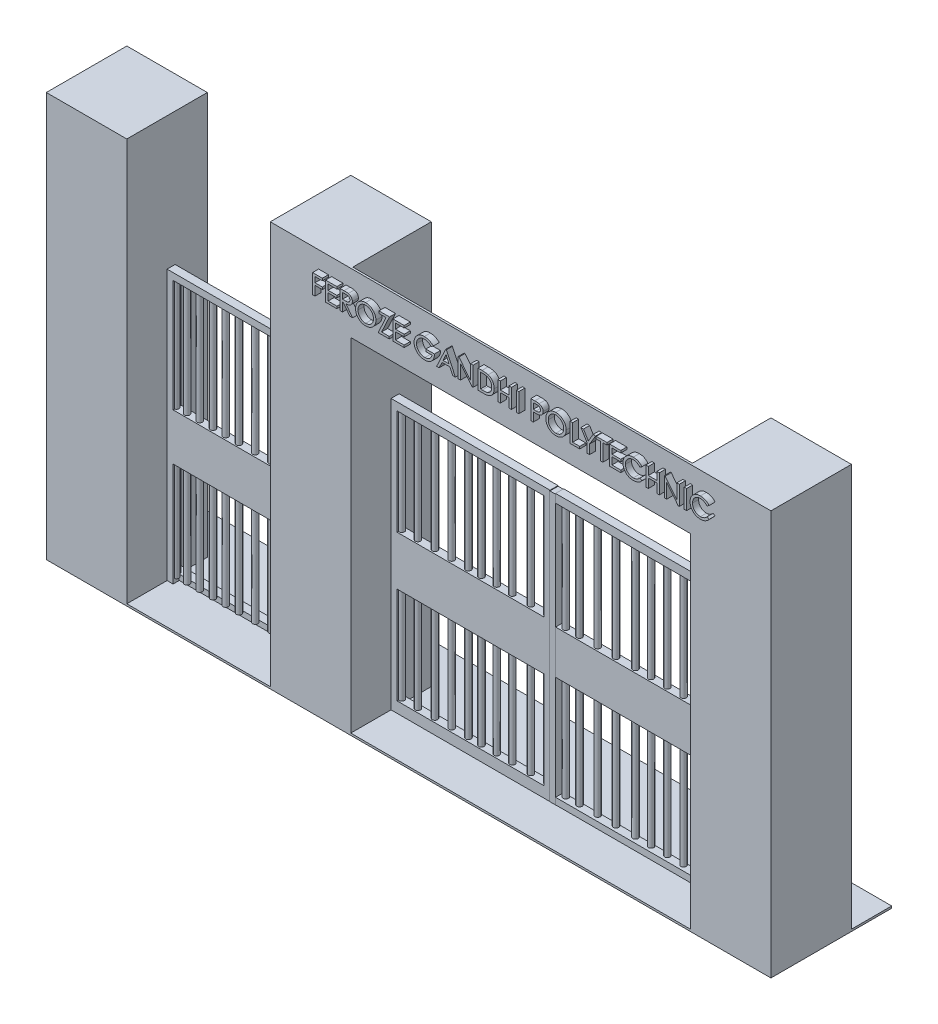
from build123d import *

# Parameters (mm, degrees)
SKETCH1_W            = 180
SKETCH1_H            = 0.5
BOSS_EXTRUDE1_DEPTH  = 30
SKETCH2_W            = 20
SKETCH2_H            = 20
BOSS_EXTRUDE2_DEPTH  = 100
SKETCH3_W            = 18.9993131
SKETCH3_H            = 18.969298387
CUT_EXTRUDE1_DEPTH   = 99
SKETCH4_W            = 19.144751785
SKETCH4_H            = 19.144751784
CUT_EXTRUDE2_DEPTH   = 99
SKETCH5_W            = 19.220337381
SKETCH5_H            = 18.980083164
CUT_EXTRUDE3_DEPTH   = 99
SKETCH7_W            = 20
SKETCH7_H            = 20
BOSS_EXTRUDE3_DEPTH  = 0.1
SKETCH8_W            = 20
SKETCH8_H            = 20
BOSS_EXTRUDE4_DEPTH  = 0.1
SKETCH9_W            = 20
SKETCH9_H            = 20
BOSS_EXTRUDE5_DEPTH  = 0.1
SKETCH10_W           = 2
SKETCH10_H           = 67
BOSS_EXTRUDE6_DEPTH  = 1.5
SKETCH11_W           = 2
SKETCH11_H           = 1.673709461
SKETCH11_H_2         = 11.6345523
BOSS_EXTRUDE7_DEPTH  = 34
SKETCH12_W           = 2.023275833
SKETCH12_H           = 1.367785379
BOSS_EXTRUDE8_DEPTH  = 34
SKETCH13_R           = 0.668926332
SKETCH13_R_2         = 0.67
BOSS_EXTRUDE9_DEPTH  = 66
SKETCH14_W           = 2
SKETCH14_H           = 67
BOSS_EXTRUDE10_DEPTH = 1.7
SKETCH15_W           = 124.368826355
SKETCH15_H           = 14.892612829
BOSS_EXTRUDE11_DEPTH = 0.5
SKETCH16_W           = 0.610576923
SKETCH16_H           = 4.7625
BOSS_EXTRUDE12_DEPTH = 1.5
SKETCH17_W           = 2
SKETCH17_H           = 67
BOSS_EXTRUDE13_DEPTH = 1.5
SKETCH18_W           = 2
SKETCH18_H           = 1.919088728
SKETCH18_H_2         = 12.226633401
SKETCH18_H_3         = 2.676174389
BOSS_EXTRUDE14_DEPTH = 38
SKETCH20_W           = 2
SKETCH20_H           = 67
BOSS_EXTRUDE15_DEPTH = 1.5
SKETCH21_W           = 2
SKETCH21_H           = 67
BOSS_EXTRUDE16_DEPTH = 1.5
SKETCH22_W           = 2
SKETCH22_H           = 2.09794553
SKETCH22_H_2         = 10.803390943
SKETCH22_H_3         = 1.625050374
BOSS_EXTRUDE17_DEPTH = 42
SKETCH23_W           = 2.02893277
SKETCH23_H           = 66.865731081
BOSS_EXTRUDE18_DEPTH = 1.5
SKETCH24_R           = 0.67
BOSS_EXTRUDE19_DEPTH = 65
SKETCH25_R           = 0.67
BOSS_EXTRUDE20_DEPTH = 65


with BuildPart() as part:
    # Sketch1 → Boss-Extrude1 (new body)
    with BuildSketch(Plane.XY):
        with Locations((-90, 0.25)):
            Rectangle(SKETCH1_W, SKETCH1_H)
    extrude(amount=BOSS_EXTRUDE1_DEPTH)

    # Sketch2 → Boss-Extrude2 (add)
    with BuildSketch(Plane(origin=(0, 0.5, 0), x_dir=(1, 0, 0), z_dir=(0, 1, 0))):
        with Locations((-170, -20)):
            Rectangle(SKETCH2_W, SKETCH2_H)
        with Locations((-10, -20)):
            Rectangle(SKETCH2_W, SKETCH2_H)
        with Locations((-114.368826355, -20)):
            Rectangle(SKETCH2_W, SKETCH2_H)
    extrude(amount=BOSS_EXTRUDE2_DEPTH)

    # Sketch3 → Cut-Extrude1 (cut)
    with BuildSketch(Plane(origin=(0, 100.5, 0), x_dir=(1, 0, 0), z_dir=(0, 1, 0))):
        with Locations((-170.020602194, -19.99181704)):
            Rectangle(SKETCH3_W, SKETCH3_H)
    extrude(amount=-CUT_EXTRUDE1_DEPTH, mode=Mode.SUBTRACT)

    # Sketch4 → Cut-Extrude2 (cut)
    with BuildSketch(Plane(origin=(0, 100.5, 0), x_dir=(1, 0, 0), z_dir=(0, 1, 0))):
        with Locations((-114.383441003, -20.067839378)):
            Rectangle(SKETCH4_W, SKETCH4_H)
    extrude(amount=-CUT_EXTRUDE2_DEPTH, mode=Mode.SUBTRACT)

    # Sketch5 → Cut-Extrude3 (cut)
    with BuildSketch(Plane(origin=(0, 100.5, 0), x_dir=(1, 0, 0), z_dir=(0, 1, 0))):
        with Locations((-10.033138449, -20.09517167)):
            Rectangle(SKETCH5_W, SKETCH5_H)
    extrude(amount=-CUT_EXTRUDE3_DEPTH, mode=Mode.SUBTRACT)

    # Sketch7 → Boss-Extrude3 (add)
    with BuildSketch(Plane(origin=(0, 100.5, 0), x_dir=(1, 0, 0), z_dir=(0, 1, 0))):
        with Locations((-170, -20)):
            Rectangle(SKETCH7_W, SKETCH7_H)
    extrude(amount=-BOSS_EXTRUDE3_DEPTH)

    # Sketch8 → Boss-Extrude4 (add)
    with BuildSketch(Plane(origin=(0, 100.5, 0), x_dir=(1, 0, 0), z_dir=(0, 1, 0))):
        with Locations((-114.368826355, -20)):
            Rectangle(SKETCH8_W, SKETCH8_H)
    extrude(amount=-BOSS_EXTRUDE4_DEPTH)

    # Sketch9 → Boss-Extrude5 (add)
    with BuildSketch(Plane(origin=(0, 100.5, 0), x_dir=(1, 0, 0), z_dir=(0, 1, 0))):
        with Locations((-10, -20)):
            Rectangle(SKETCH9_W, SKETCH9_H)
    extrude(amount=-BOSS_EXTRUDE5_DEPTH)

    # Sketch10 → Boss-Extrude6 (add)
    with BuildSketch(Plane(origin=(-160, 0, 0), x_dir=(0, 0, -1), z_dir=(1, 0, 0))):
        with Locations((-19, 34)):
            Rectangle(SKETCH10_W, SKETCH10_H)
    extrude(amount=BOSS_EXTRUDE6_DEPTH)

    # Sketch11 → Boss-Extrude7 (add)
    with BuildSketch(Plane(origin=(-158.5, 0, 0), x_dir=(0, 0, -1), z_dir=(1, 0, 0))):
        with Locations((-19, 66.66314527)):
            Rectangle(SKETCH11_W, SKETCH11_H)
        with Locations((-19, 32.144750477)):
            Rectangle(SKETCH11_W, SKETCH11_H_2)
    extrude(amount=BOSS_EXTRUDE7_DEPTH)

    # Sketch12 → Boss-Extrude8 (add)
    with BuildSketch(Plane(origin=(-160, 0, 0), x_dir=(0, 0, -1), z_dir=(1, 0, 0))):
        with Locations((-17.506346466, 1.240598384)):
            Rectangle(SKETCH12_W, SKETCH12_H)
    extrude(amount=BOSS_EXTRUDE8_DEPTH)

    # Sketch13 → Boss-Extrude9 (add)
    with BuildSketch(Plane(origin=(0, 67.5, 0), x_dir=(1, 0, 0), z_dir=(0, 1, 0))):
        with Locations((-158.696712227, -19)):
            Circle(SKETCH13_R)
        with Locations((-156.001147087, -19)):
            Circle(SKETCH13_R_2)
        with Locations((-152.870813376, -19)):
            Circle(SKETCH13_R_2)
        with Locations((-149.595556808, -19)):
            Circle(SKETCH13_R_2)
        with Locations((-146.407253955, -19)):
            Circle(SKETCH13_R_2)
        with Locations((-143.131997387, -19)):
            Circle(SKETCH13_R_2)
        with Locations((-139.074157391, -19)):
            Circle(SKETCH13_R_2)
        with Locations((-135.074286539, -19)):
            Circle(SKETCH13_R_2)
        with Locations((-131.422230543, -19)):
            Circle(SKETCH13_R_2)
        with Locations((-127.712205404, -19)):
            Circle(SKETCH13_R_2)
    extrude(amount=-BOSS_EXTRUDE9_DEPTH)

    # Sketch14 → Boss-Extrude10 (add)
    with BuildSketch(Plane.ZY.offset(124.368826355)):
        with Locations((19.075616375, 33.996761098)):
            Rectangle(SKETCH14_W, SKETCH14_H)
    extrude(amount=BOSS_EXTRUDE10_DEPTH)

    # Sketch15 → Boss-Extrude11 (add)
    with BuildSketch(Plane.XY.offset(30)):
        with Locations((-62.184413178, 93.053693585)):
            Rectangle(SKETCH15_W, SKETCH15_H)
    extrude(amount=-BOSS_EXTRUDE11_DEPTH)

    # Sketch16 → Boss-Extrude12 (add)
    # profile 1 of 23: a face of its own
    with BuildSketch(Plane.XY.offset(30)):
        Polygon((-112.366769524, 96.332104114), (-109.924461832, 96.332104114), (-109.924461832, 95.782584883), (-111.756192601, 95.782584883), (-111.756192601, 94.439315652), (-109.924461832, 94.439315652), (-109.924461832, 93.889796422), (-111.756192601, 93.889796422), (-111.756192601, 91.569604114), (-112.366769524, 91.569604114), align=None)
    # profile 2 of 23: a face of its own
    with BuildSketch(Plane.XY.offset(30)):
        Polygon((-109.130711832, 96.332104114), (-106.322057986, 96.332104114), (-106.322057986, 95.782584883), (-108.520134909, 95.782584883), (-108.520134909, 94.439315652), (-106.322057986, 94.439315652), (-106.322057986, 93.889796422), (-108.520134909, 93.889796422), (-108.520134909, 92.119123345), (-106.322057986, 92.119123345), (-106.322057986, 91.569604114), (-109.130711832, 91.569604114), align=None)
    # profile 3 of 23: a face of its own
    with BuildSketch(Plane.XY.offset(30)):
        with BuildLine():
            Line((-105.528307986, 96.332104114), (-104.553292962, 96.332104114))
            add(Edge.make_bspline(
                [(-104.553292962, 96.332104114), (-104.490643227, 96.331952632), (-104.370742867, 96.331662723), (-104.198695352, 96.328620523), (-104.042480786, 96.324591398), (-103.901981105, 96.316175141), (-103.776820067, 96.308746234), (-103.667539014, 96.296527763), (-103.573623442, 96.285630209), (-103.517158493, 96.273640712), (-103.491461532, 96.268184342)],
                knots=[0, 0, 0, 0, 1.411347063, 2.701065231, 3.876524531, 4.931206492, 5.871916627, 6.700262025, 7.408494688, 8, 8, 8, 8], degree=3))
            add(Edge.make_bspline(
                [(-103.491461532, 96.268184342), (-103.453145404, 96.258552152), (-103.377656796, 96.239575269), (-103.268900466, 96.202213809), (-103.166224756, 96.158167327), (-103.069764993, 96.107678083), (-102.979289249, 96.050492475), (-102.896547926, 95.984885346), (-102.818281512, 95.91420797), (-102.747509906, 95.836242922), (-102.683118448, 95.753336299), (-102.628062065, 95.665502712), (-102.580823204, 95.57392177), (-102.541397056, 95.478729608), (-102.511917474, 95.378864696), (-102.491268735, 95.275062025), (-102.477058095, 95.167629883), (-102.475971751, 95.094460377), (-102.47542337, 95.057524787)],
                knots=[0, 0, 0, 0, 1.103820101, 2.174693741, 3.209859002, 4.223626675, 5.214778413, 6.196198804, 7.171320727, 8.158999421, 9.134971582, 10.10159085, 11.051641808, 12.012235658, 12.97676874, 13.956376421, 14.968389326, 16, 16, 16, 16], degree=3))
            add(Edge.make_bspline(
                [(-102.47542337, 95.057524787), (-102.47746479, 94.996609765), (-102.481476869, 94.876891168), (-102.51793871, 94.702290553), (-102.577689416, 94.537703902), (-102.64584129, 94.409132753), (-102.71214081, 94.313547964), (-102.767648048, 94.245594511), (-102.828672228, 94.181932614), (-102.894780651, 94.121899491), (-102.967713061, 94.068148048), (-103.04524455, 94.017183267), (-103.128289707, 93.970332261), (-103.247994851, 93.914076007), (-103.409903073, 93.855441126), (-103.619100869, 93.805173348), (-103.845154929, 93.774639158), (-104.001450841, 93.770047515), (-104.082003899, 93.767681037)],
                knots=[0, 0, 0, 0, 1.258986715, 2.474334223, 3.670931197, 4.871716255, 5.472099774, 6.075216246, 6.684756624, 7.295006596, 7.919971941, 8.55677058, 9.213641309, 9.890468445, 11.291088691, 12.766994829, 14.333747493, 16, 16, 16, 16], degree=3))
            Line((-104.082003899, 93.767681037), (-102.414365678, 91.569604114))
            Line((-102.414365678, 91.569604114), (-103.08695432, 91.569604114))
            Line((-103.08695432, 91.569604114), (-104.754592541, 93.767681037))
            Line((-104.754592541, 93.767681037), (-104.917731063, 93.767681037))
            Line((-104.917731063, 93.767681037), (-104.917731063, 91.569604114))
            Line((-104.917731063, 91.569604114), (-105.528307986, 91.569604114))
            Line((-105.528307986, 91.569604114), (-105.528307986, 96.332104114))
        make_face()
        with BuildLine():
            Line((-104.917731063, 95.782584883), (-104.917731063, 94.316246241))
            Line((-104.917731063, 94.316246241), (-104.217475654, 94.311476109))
            add(Edge.make_bspline(
                [(-104.217475654, 94.311476109), (-104.179947098, 94.311573075), (-104.10741243, 94.31176049), (-104.002419754, 94.315619603), (-103.905036513, 94.322081801), (-103.815647377, 94.331652699), (-103.734511621, 94.343071103), (-103.661007311, 94.355859811), (-103.595824641, 94.37312865), (-103.519683096, 94.398021055), (-103.435088881, 94.438013056), (-103.345350096, 94.49890254), (-103.266690884, 94.570963751), (-103.202186256, 94.655400742), (-103.150575657, 94.748037419), (-103.113030126, 94.846945511), (-103.09041298, 94.951567506), (-103.087487931, 95.023068473), (-103.086000294, 95.05943284)],
                knots=[0, 0, 0, 0, 1.165824803, 2.253289887, 3.263370799, 4.197285623, 5.045371766, 5.808848116, 6.513348392, 7.138183875, 8.296069948, 9.40583476, 10.496436725, 11.595152671, 12.691956992, 13.780050175, 14.870965332, 16, 16, 16, 16], degree=3))
            add(Edge.make_bspline(
                [(-103.086000294, 95.05943284), (-103.087558309, 95.094511438), (-103.090648574, 95.16408852), (-103.112627864, 95.266201758), (-103.151915176, 95.36253568), (-103.204040498, 95.452966452), (-103.268626292, 95.534262854), (-103.34290143, 95.605899009), (-103.42870462, 95.662680633), (-103.507699444, 95.701004412), (-103.578496148, 95.725039648), (-103.641183666, 95.739882799), (-103.712536386, 95.752988919), (-103.792700097, 95.764508095), (-103.881526645, 95.772924125), (-103.979237604, 95.778218902), (-104.085784755, 95.782379089), (-104.159911357, 95.782514554), (-104.198395125, 95.782584883)],
                knots=[0, 0, 0, 0, 1.114111647, 2.20979856, 3.297775031, 4.406653707, 5.514151176, 6.585969385, 7.670234779, 8.768154562, 9.365517569, 10.041721951, 10.812428959, 11.669578816, 12.61341719, 13.645562296, 14.777663698, 16, 16, 16, 16], degree=3))
            Line((-104.198395125, 95.782584883), (-104.917731063, 95.782584883))
        make_face(mode=Mode.SUBTRACT)
    # profile 4 of 23: a face of its own
    with BuildSketch(Plane.XY.offset(30)):
        with BuildLine():
            add(Edge.make_bspline(
                [(-99.207882806, 96.454219498), (-99.116501085, 96.452109818), (-98.936888485, 96.447963199), (-98.673397936, 96.412608972), (-98.421772763, 96.356049544), (-98.182384114, 96.275262504), (-97.955070374, 96.171749843), (-97.739472927, 96.045312625), (-97.536232003, 95.895567823), (-97.347832477, 95.724435027), (-97.176694842, 95.538019716), (-97.025030225, 95.340966575), (-96.899089848, 95.132403139), (-96.793809997, 94.915347445), (-96.714148717, 94.68778585), (-96.655128244, 94.451646392), (-96.620319442, 94.205347109), (-96.616050715, 94.03778), (-96.613884909, 93.952762167)],
                knots=[0, 0, 0, 0, 1.090651108, 2.14369656, 3.167927427, 4.165692988, 5.154576575, 6.145033357, 7.14440862, 8.163220312, 9.178978109, 10.162394332, 11.12677451, 12.082874982, 13.037579715, 13.999894772, 14.985214855, 16, 16, 16, 16], degree=3))
            add(Edge.make_bspline(
                [(-96.613884909, 93.952762167), (-96.616009073, 93.868369622), (-96.620195398, 93.702047838), (-96.655673021, 93.457249414), (-96.71286877, 93.22139609), (-96.792967126, 92.994028577), (-96.898041023, 92.776881153), (-97.024611274, 92.56813197), (-97.175363416, 92.36977497), (-97.345862438, 92.18205474), (-97.533229342, 92.010307546), (-97.73441172, 91.859475031), (-97.946969226, 91.732522144), (-98.169842966, 91.626839682), (-98.404856141, 91.547496423), (-98.650253982, 91.488660077), (-98.907002448, 91.453898004), (-99.081846206, 91.449647966), (-99.170675774, 91.447488729)],
                knots=[0, 0, 0, 0, 1.015667565, 2.001689161, 2.971180881, 3.933912672, 4.898051938, 5.870540525, 6.8683264, 7.892867857, 8.919988739, 9.923897136, 10.914753654, 11.896185405, 12.887840524, 13.895451133, 14.930781579, 16, 16, 16, 16], degree=3))
            add(Edge.make_bspline(
                [(-99.170675774, 91.447488729), (-99.257297668, 91.449582679), (-99.427743767, 91.45370295), (-99.677790928, 91.489393718), (-99.917690261, 91.545033143), (-100.147131805, 91.624997557), (-100.366479999, 91.726990717), (-100.574485156, 91.85351084), (-100.772985172, 92.000867904), (-100.958204321, 92.169678417), (-101.127241938, 92.354535936), (-101.275513634, 92.551309732), (-101.401619546, 92.757496605), (-101.504204498, 92.973332389), (-101.584121458, 93.19902207), (-101.639560512, 93.434511403), (-101.675450345, 93.679129184), (-101.679578648, 93.845465576), (-101.68167337, 93.929865532)],
                knots=[0, 0, 0, 0, 1.056734814, 2.079339537, 3.076314658, 4.058285941, 5.039336339, 6.023146808, 7.024524339, 8.052147497, 9.076900738, 10.077495695, 11.054668894, 12.021676166, 12.988994953, 13.970866516, 14.970407042, 16, 16, 16, 16], degree=3))
            add(Edge.make_bspline(
                [(-101.68167337, 93.929865532), (-101.680946554, 93.986515961), (-101.67950209, 94.099102147), (-101.662086398, 94.266284647), (-101.636866157, 94.430796677), (-101.600531783, 94.592084588), (-101.553666224, 94.750177086), (-101.49590239, 94.904742035), (-101.429741925, 95.057085819), (-101.350828338, 95.204184434), (-101.265150281, 95.346892149), (-101.16994333, 95.481376114), (-101.069235453, 95.609273922), (-100.958786488, 95.727171358), (-100.842289306, 95.83852475), (-100.717839955, 95.941615848), (-100.586201572, 96.037376134), (-100.446806716, 96.123673075), (-100.303090433, 96.201722475), (-100.154940243, 96.268699349), (-100.004368266, 96.326184169), (-99.850669263, 96.372776149), (-99.694251384, 96.409559026), (-99.534773241, 96.434606175), (-99.372361886, 96.452056408), (-99.262945055, 96.453495366), (-99.207882806, 96.454219498)],
                knots=[0, 0, 0, 0, 1.036913812, 2.060746492, 3.074578145, 4.08324605, 5.085523353, 6.091481477, 7.103103322, 8.124200051, 9.145827961, 10.149052085, 11.139400635, 12.124186929, 13.104469564, 14.088618662, 15.081002312, 16.082788945, 17.088477375, 18.073521874, 19.057670972, 20.037642247, 21.012252997, 21.997331918, 22.992189685, 24, 24, 24, 24], degree=3))
        make_face()
        with BuildLine():
            add(Edge.make_bspline(
                [(-99.18784825, 95.904700268), (-99.227952845, 95.904065432), (-99.307721779, 95.90280273), (-99.4265562, 95.889585475), (-99.544160069, 95.869731251), (-99.66073709, 95.841808405), (-99.776383376, 95.806918228), (-99.890103539, 95.7622839), (-100.002996348, 95.711214521), (-100.113048099, 95.650678123), (-100.220330191, 95.584966006), (-100.32180331, 95.511607156), (-100.418632051, 95.433629689), (-100.509421049, 95.348406545), (-100.593999853, 95.257053463), (-100.672838146, 95.159720702), (-100.746537666, 95.056744911), (-100.813484511, 94.947412321), (-100.875317453, 94.833985745), (-100.927366842, 94.715730875), (-100.971456532, 94.59390592), (-101.007642357, 94.468639151), (-101.036634531, 94.339682756), (-101.056031909, 94.20698893), (-101.06929107, 94.070694849), (-101.070488508, 93.978553664), (-101.071096447, 93.931773585)],
                knots=[0, 0, 0, 0, 0.951425037, 1.892405618, 2.834142553, 3.780555396, 4.735506122, 5.698386817, 6.677778342, 7.674036042, 8.677244726, 9.661625187, 10.643485342, 11.625954439, 12.613944774, 13.595804929, 14.596853729, 15.616869823, 16.636634596, 17.660413109, 18.67984269, 19.709280547, 20.753005387, 21.813969624, 22.890152378, 24, 24, 24, 24], degree=3))
            add(Edge.make_bspline(
                [(-101.071096447, 93.931773585), (-101.069619673, 93.863622415), (-101.06672319, 93.729953531), (-101.038789415, 93.533887209), (-100.995482455, 93.346531635), (-100.934183469, 93.168076431), (-100.855254514, 92.998575596), (-100.758651465, 92.838078094), (-100.644212383, 92.686181751), (-100.513302545, 92.545805466), (-100.371383169, 92.417540527), (-100.220849037, 92.305771913), (-100.065146559, 92.209123151), (-99.901776966, 92.131656205), (-99.732341597, 92.071284995), (-99.556552807, 92.028326688), (-99.374378129, 92.001766123), (-99.250586562, 91.998608342), (-99.18784825, 91.99700796)],
                knots=[0, 0, 0, 0, 1.087324682, 2.132633634, 3.154656843, 4.153212625, 5.138884617, 6.133989092, 7.13811672, 8.169089965, 9.193543553, 10.187520856, 11.158295186, 12.114249704, 13.068004623, 14.02467326, 14.998892505, 16, 16, 16, 16], degree=3))
            add(Edge.make_bspline(
                [(-99.18784825, 91.99700796), (-99.143296402, 91.997644468), (-99.054969411, 91.998906389), (-98.924034408, 92.011939259), (-98.795690129, 92.032034202), (-98.669860955, 92.05908535), (-98.546921501, 92.096394302), (-98.425944029, 92.139315857), (-98.308256462, 92.192843611), (-98.193013357, 92.252060778), (-98.083156755, 92.32016357), (-97.977448607, 92.392561534), (-97.878025095, 92.471336497), (-97.786793151, 92.558063381), (-97.700033433, 92.648813465), (-97.620100851, 92.746133036), (-97.546436425, 92.849386745), (-97.479779022, 92.958243949), (-97.419989788, 93.071400697), (-97.366847514, 93.18801773), (-97.323653934, 93.308267072), (-97.286589431, 93.43097253), (-97.259261504, 93.55738639), (-97.239501313, 93.686743813), (-97.226309556, 93.819244743), (-97.22508276, 93.908527045), (-97.224461832, 93.953716193)],
                knots=[0, 0, 0, 0, 1.036970321, 2.055862331, 3.060095599, 4.060719653, 5.049301004, 6.049377071, 7.046955997, 8.056986028, 9.063944937, 10.053856218, 11.039021426, 12.013303897, 12.982198174, 13.960523328, 14.942567566, 15.933032457, 16.929951754, 17.920776327, 18.913894254, 19.902475604, 20.903099658, 21.921964767, 22.948227815, 24, 24, 24, 24], degree=3))
            add(Edge.make_bspline(
                [(-97.224461832, 93.953716193), (-97.225085605, 93.998587256), (-97.226317933, 94.087234674), (-97.239435043, 94.218474723), (-97.259238353, 94.346249028), (-97.286758415, 94.47102112), (-97.323466295, 94.592244343), (-97.366882147, 94.710846488), (-97.419992469, 94.825565802), (-97.479815627, 94.936796763), (-97.546602617, 95.04420897), (-97.621121606, 95.145787463), (-97.701324808, 95.242707051), (-97.788400155, 95.333539623), (-97.882405074, 95.41861618), (-97.982446833, 95.498573937), (-98.088826555, 95.573721031), (-98.201807212, 95.641395989), (-98.318371836, 95.703577893), (-98.437900343, 95.756605912), (-98.558325479, 95.803015901), (-98.680757614, 95.84029988), (-98.805173556, 95.868727966), (-98.931264391, 95.889937419), (-99.05910684, 95.902686977), (-99.144888842, 95.904028458), (-99.18784825, 95.904700268)],
                knots=[0, 0, 0, 0, 1.048789873, 2.071992723, 3.080474812, 4.070813472, 5.056451928, 6.039816187, 7.021295338, 8.009314668, 8.991328769, 9.975844821, 10.952581135, 11.930703152, 12.91499457, 13.914777939, 14.923479275, 15.957618598, 16.991998452, 18.010408503, 19.012925223, 20.00783076, 20.999814803, 21.994803685, 22.995802798, 24, 24, 24, 24], degree=3))
        make_face(mode=Mode.SUBTRACT)
    # profile 5 of 23: a face of its own
    with BuildSketch(Plane.XY.offset(30)):
        Polygon((-95.881192601, 95.782584883), (-95.881192601, 96.332104114), (-93.255711832, 96.332104114), (-95.22196033, 92.119123345), (-93.316769524, 92.119123345), (-93.316769524, 91.569604114), (-96.064365678, 91.569604114), (-94.097163154, 95.782584883), align=None)
    # profile 6 of 23: a face of its own
    with BuildSketch(Plane.XY.offset(30)):
        Polygon((-92.40090414, 96.332104114), (-89.592250294, 96.332104114), (-89.592250294, 95.782584883), (-91.790327217, 95.782584883), (-91.790327217, 94.439315652), (-89.592250294, 94.439315652), (-89.592250294, 93.889796422), (-91.790327217, 93.889796422), (-91.790327217, 92.119123345), (-89.592250294, 92.119123345), (-89.592250294, 91.569604114), (-92.40090414, 91.569604114), align=None)
    # profile 7 of 23: a face of its own
    with BuildSketch(Plane.XY.offset(30)):
        with BuildLine():
            Line((-82.387442601, 95.513549426), (-82.850145426, 95.110950268))
            add(Edge.make_bspline(
                [(-82.850145426, 95.110950268), (-82.922737165, 95.174337504), (-83.064054303, 95.297735881), (-83.285327083, 95.460738954), (-83.507838002, 95.598227584), (-83.731645976, 95.708560432), (-83.952973202, 95.796929816), (-84.172828221, 95.85768346), (-84.389462905, 95.897374734), (-84.533520023, 95.902279955), (-84.604600053, 95.904700268)],
                knots=[0, 0, 0, 0, 1.174203348, 2.285866929, 3.345479548, 4.357773815, 5.323690501, 6.245291137, 7.134199255, 8, 8, 8, 8], degree=3))
            add(Edge.make_bspline(
                [(-84.604600053, 95.904700268), (-84.645657478, 95.904057115), (-84.727643954, 95.902772819), (-84.849965454, 95.889566502), (-84.9710943, 95.86986683), (-85.091104233, 95.841673244), (-85.210249141, 95.806910844), (-85.327617019, 95.762580898), (-85.443930057, 95.710726591), (-85.55824556, 95.651052046), (-85.669355603, 95.584853479), (-85.774957787, 95.511998527), (-85.874393738, 95.43260549), (-85.967849798, 95.346898994), (-86.054777111, 95.254748223), (-86.136463893, 95.157478871), (-86.210794475, 95.052810752), (-86.279215776, 94.942997889), (-86.339553854, 94.828820175), (-86.393862442, 94.713025157), (-86.438570975, 94.594630819), (-86.474753376, 94.474031329), (-86.503571693, 94.351384416), (-86.524491583, 94.226825189), (-86.537437286, 94.099958315), (-86.538719018, 94.014804568), (-86.539365678, 93.971842696)],
                knots=[0, 0, 0, 0, 0.9732313, 1.943419598, 2.914105962, 3.881741322, 4.864768402, 5.855028487, 6.854206409, 7.882911434, 8.911035887, 9.919250175, 10.922630637, 11.925982763, 12.923451909, 13.924676513, 14.935397504, 15.964931351, 16.990480746, 17.995899336, 18.995873688, 19.988284801, 20.979664002, 21.981342857, 22.981544644, 24, 24, 24, 24], degree=3))
            add(Edge.make_bspline(
                [(-86.539365678, 93.971842696), (-86.538271979, 93.927934996), (-86.536088345, 93.840270675), (-86.523965154, 93.709777693), (-86.501770427, 93.581683816), (-86.470940545, 93.455844663), (-86.43198975, 93.332105607), (-86.384219069, 93.210147972), (-86.326347179, 93.091193891), (-86.26216833, 92.974150422), (-86.189947075, 92.861818645), (-86.110198096, 92.755936627), (-86.025613798, 92.655136702), (-85.933655192, 92.562225011), (-85.837094127, 92.474092794), (-85.732564162, 92.394614604), (-85.623002432, 92.319883865), (-85.507679161, 92.252185491), (-85.387615029, 92.192481112), (-85.264800391, 92.139802507), (-85.138834013, 92.095761083), (-85.010493843, 92.0594599), (-84.879106645, 92.031855919), (-84.745625785, 92.012047087), (-84.609316589, 91.998858323), (-84.517496743, 91.997629658), (-84.471036351, 91.99700796)],
                knots=[0, 0, 0, 0, 0.993588149, 1.983757546, 2.962012758, 3.932297264, 4.913089422, 5.895147596, 6.892791648, 7.904042674, 8.913936126, 9.911190904, 10.901569418, 11.888649192, 12.866825019, 13.856968273, 14.856789458, 15.866221433, 16.879824684, 17.888846278, 18.887838639, 19.896937192, 20.90452114, 21.923117541, 22.949107649, 24, 24, 24, 24], degree=3))
            add(Edge.make_bspline(
                [(-84.471036351, 91.99700796), (-84.413101022, 91.998311753), (-84.298821406, 92.000883535), (-84.131076248, 92.020576572), (-83.969769851, 92.050983081), (-83.816545787, 92.098241775), (-83.668960835, 92.154451937), (-83.529216636, 92.22605777), (-83.395639918, 92.309081984), (-83.271101008, 92.405409592), (-83.155037889, 92.509160605), (-83.051679398, 92.620854791), (-82.959246124, 92.736868264), (-82.881314566, 92.859987154), (-82.813668286, 92.986760704), (-82.760083446, 93.119861719), (-82.718546935, 93.258159142), (-82.701368899, 93.35342914), (-82.692731063, 93.401334883)],
                knots=[0, 0, 0, 0, 1.125101743, 2.219305524, 3.276925285, 4.308813505, 5.329771737, 6.340890082, 7.353855978, 8.380572537, 9.395307413, 10.374367262, 11.333343716, 12.272376171, 13.200803521, 14.12078735, 15.055053215, 16, 16, 16, 16], degree=3))
            Line((-82.692731063, 93.401334883), (-84.21917337, 93.401334883))
            Line((-84.21917337, 93.401334883), (-84.21917337, 93.950854114))
            Line((-84.21917337, 93.950854114), (-82.08215414, 93.950854114))
            add(Edge.make_bspline(
                [(-82.08215414, 93.950854114), (-82.084318349, 93.856613967), (-82.088543128, 93.672646619), (-82.122460147, 93.404483569), (-82.172469145, 93.15089697), (-82.245531452, 92.912956547), (-82.33810611, 92.690326959), (-82.451171671, 92.48300292), (-82.584506008, 92.291044839), (-82.737209714, 92.115535155), (-82.906979311, 91.958105264), (-83.092014292, 91.820237755), (-83.293144207, 91.70581183), (-83.507800201, 91.610751302), (-83.737170715, 91.537302252), (-83.98066517, 91.48527889), (-84.238663937, 91.453095854), (-84.415606275, 91.449389303), (-84.50633533, 91.447488729)],
                knots=[0, 0, 0, 0, 1.147910205, 2.240849596, 3.288798376, 4.293882934, 5.268269983, 6.221997348, 7.165762291, 8.110600512, 9.051082397, 9.981847279, 10.915696266, 11.864665164, 12.837641225, 13.844673414, 14.894833504, 16, 16, 16, 16], degree=3))
            add(Edge.make_bspline(
                [(-84.50633533, 91.447488729), (-84.559779066, 91.448269817), (-84.665496478, 91.449814892), (-84.821785774, 91.460641006), (-84.974070918, 91.477370597), (-85.121722374, 91.50248467), (-85.265537601, 91.533555518), (-85.404345475, 91.573292481), (-85.540034783, 91.617324439), (-85.67020478, 91.671756609), (-85.79762817, 91.730165634), (-85.920191792, 91.797386613), (-86.038008098, 91.872260014), (-86.15357088, 91.951822644), (-86.262438877, 92.041101507), (-86.368263532, 92.135830359), (-86.469414304, 92.237930649), (-86.533056454, 92.310546212), (-86.565124392, 92.347135664)],
                knots=[0, 0, 0, 0, 1.103516608, 2.18287355, 3.233646581, 4.265703846, 5.274262808, 6.270085734, 7.246073526, 8.217965859, 9.181570311, 10.139587173, 11.101556858, 12.063436887, 13.034641265, 14.006444858, 14.995489556, 16, 16, 16, 16], degree=3))
            add(Edge.make_bspline(
                [(-86.565124392, 92.347135664), (-86.612122041, 92.40508879), (-86.705107727, 92.519750083), (-86.822274469, 92.705479622), (-86.925138104, 92.895592453), (-87.006913023, 93.094082145), (-87.071158846, 93.299012423), (-87.117234992, 93.510945997), (-87.144039639, 93.729783076), (-87.147962298, 93.877957995), (-87.149942601, 93.952762167)],
                knots=[0, 0, 0, 0, 1.024988564, 2.027958144, 3.013741914, 3.99376912, 4.974186348, 5.962951834, 6.97162285, 8, 8, 8, 8], degree=3))
            add(Edge.make_bspline(
                [(-87.149942601, 93.952762167), (-87.149229252, 94.00877829), (-87.147815652, 94.119781995), (-87.130281367, 94.284728931), (-87.105137693, 94.447026061), (-87.068809735, 94.606417035), (-87.021880436, 94.762576873), (-86.964192655, 94.91572982), (-86.896850033, 95.066410763), (-86.818162285, 95.212782261), (-86.732522075, 95.354812551), (-86.636275048, 95.488089322), (-86.534354305, 95.615121425), (-86.423191747, 95.732859223), (-86.305977035, 95.844578705), (-86.179312468, 95.946351394), (-86.045823276, 96.041200971), (-85.904362703, 96.126851567), (-85.757238661, 96.203820003), (-85.604763134, 96.271324404), (-85.447233948, 96.326876069), (-85.285748503, 96.37456005), (-85.119055049, 96.409239273), (-84.948023487, 96.434846975), (-84.772223362, 96.452067714), (-84.653296383, 96.45349678), (-84.593151736, 96.454219498)],
                knots=[0, 0, 0, 0, 1.010042427, 2.001538926, 2.988977894, 3.97147212, 4.947868168, 5.928132478, 6.921817128, 7.922678872, 8.924230854, 9.911186466, 10.885946514, 11.860014231, 12.829900618, 13.804660667, 14.788293046, 15.781961137, 16.785220236, 17.781814947, 18.787040195, 19.796447094, 20.816926666, 21.855387176, 22.915410262, 24, 24, 24, 24], degree=3))
            add(Edge.make_bspline(
                [(-84.593151736, 96.454219498), (-84.542576367, 96.453322232), (-84.441976428, 96.451537469), (-84.292285327, 96.442249546), (-84.144807873, 96.425156028), (-83.999869186, 96.39966924), (-83.856603484, 96.369944488), (-83.716332386, 96.331360155), (-83.578509925, 96.286391109), (-83.442459251, 96.234734455), (-83.307618053, 96.175503278), (-83.17360802, 96.107762553), (-83.04100133, 96.029823525), (-82.908399582, 95.94414022), (-82.776633109, 95.84951632), (-82.645911638, 95.745894335), (-82.514650425, 95.634711808), (-82.430299463, 95.554369553), (-82.387442601, 95.513549426)],
                knots=[0, 0, 0, 0, 0.985310127, 1.959889608, 2.920407961, 3.875718043, 4.825872088, 5.769643135, 6.708031182, 7.649175746, 8.603380435, 9.575831151, 10.572468945, 11.59831001, 12.650450436, 13.731164539, 14.847254788, 16, 16, 16, 16], degree=3))
        make_face()
    # profile 8 of 23: a face of its own
    with BuildSketch(Plane.XY.offset(30)):
        Polygon((-79.120856063, 96.332104114), (-76.892250294, 91.569604114), (-77.519045666, 91.569604114), (-78.242197709, 93.096046422), (-80.190319705, 93.096046422), (-80.913471748, 91.569604114), (-81.532634909, 91.569604114), (-79.311661351, 96.332104114), align=None)
        Polygon((-79.216258707, 95.291261265), (-79.957537253, 93.645565652), (-78.46734795, 93.645565652), align=None, mode=Mode.SUBTRACT)
    # profile 9 of 23: a face of its own
    with BuildSketch(Plane.XY.offset(30)):
        Polygon((-76.220615678, 91.569604114), (-76.220615678, 96.332104114), (-75.994511411, 96.332104114), (-73.10667337, 92.713481818), (-73.10667337, 96.332104114), (-72.496096447, 96.332104114), (-72.496096447, 91.569604114), (-72.746051375, 91.569604114), (-75.610038755, 95.178686145), (-75.610038755, 91.569604114), align=None)
    # profile 10 of 23: a face of its own
    with BuildSketch(Plane.XY.offset(30)):
        with BuildLine():
            Line((-71.274942601, 91.569604114), (-71.274942601, 96.332104114))
            Line((-71.274942601, 96.332104114), (-70.266536652, 96.332104114))
            add(Edge.make_bspline(
                [(-70.266536652, 96.332104114), (-70.181622399, 96.33151224), (-70.018118282, 96.330372574), (-69.781748612, 96.322898682), (-69.563762343, 96.31004719), (-69.363692373, 96.290675941), (-69.181739707, 96.267893648), (-69.017962159, 96.237753079), (-68.871733776, 96.205261694), (-68.782192885, 96.175381739), (-68.740094344, 96.161333381)],
                knots=[0, 0, 0, 0, 1.321377177, 2.544338591, 3.679698859, 4.71869479, 5.671952218, 6.531967125, 7.309789724, 8, 8, 8, 8], degree=3))
            add(Edge.make_bspline(
                [(-68.740094344, 96.161333381), (-68.681151765, 96.139123084), (-68.564814458, 96.095285739), (-68.399980225, 96.012997393), (-68.244251586, 95.922718295), (-68.09956887, 95.820240723), (-67.966208362, 95.706210239), (-67.841881382, 95.583117428), (-67.730424054, 95.447373436), (-67.628328552, 95.302809273), (-67.53786769, 95.149257754), (-67.459565975, 94.988735795), (-67.393433524, 94.821551626), (-67.33904503, 94.648130828), (-67.297362375, 94.468161216), (-67.266561103, 94.282132413), (-67.248156617, 94.089563054), (-67.246150597, 93.958844131), (-67.245134909, 93.892658501)],
                knots=[0, 0, 0, 0, 1.037989101, 2.048720264, 3.03347809, 4.003905725, 4.967380877, 5.923996735, 6.884742632, 7.859453364, 8.839691521, 9.819957728, 10.801471334, 11.80152298, 12.813966534, 13.844978706, 14.908869198, 16, 16, 16, 16], degree=3))
            add(Edge.make_bspline(
                [(-67.245134909, 93.892658501), (-67.246022253, 93.835385678), (-67.247775123, 93.722248322), (-67.262602585, 93.554687918), (-67.286068436, 93.39183016), (-67.319610425, 93.233779453), (-67.36249795, 93.080759533), (-67.41533515, 92.932340662), (-67.476931008, 92.788333652), (-67.548742009, 92.65037887), (-67.627458041, 92.518890942), (-67.71351719, 92.395763689), (-67.805204823, 92.280955711), (-67.902731817, 92.174455555), (-68.00700514, 92.076827417), (-68.117888054, 91.988145972), (-68.234725079, 91.907503646), (-68.358645966, 91.835456828), (-68.491966445, 91.771401374), (-68.637143988, 91.717637934), (-68.794465704, 91.672161418), (-68.963774201, 91.633495936), (-69.145958885, 91.605969627), (-69.340117731, 91.585136632), (-69.546360488, 91.571114125), (-69.688054655, 91.570116839), (-69.760902637, 91.569604114)],
                knots=[0, 0, 0, 0, 1.058131973, 2.090245403, 3.105765157, 4.096918797, 5.07359586, 6.040054961, 7.006085223, 7.965371986, 8.911666288, 9.835956746, 10.738988486, 11.624821356, 12.502036588, 13.375701924, 14.24610047, 15.122941669, 16.021834204, 16.975760622, 17.979893693, 19.046217526, 20.182340398, 21.382202726, 22.654134781, 24, 24, 24, 24], degree=3))
            Line((-69.760902637, 91.569604114), (-71.274942601, 91.569604114))
        make_face()
        with BuildLine():
            Line((-70.664365678, 92.119123345), (-70.250318202, 92.119123345))
            add(Edge.make_bspline(
                [(-70.250318202, 92.119123345), (-70.173990088, 92.119417323), (-70.027353044, 92.119982098), (-69.816507224, 92.126242492), (-69.623965088, 92.133717279), (-69.450344304, 92.147595492), (-69.295264454, 92.163084018), (-69.158722308, 92.183097153), (-69.040159636, 92.205602685), (-68.968615218, 92.226736635), (-68.935669765, 92.236468597)],
                knots=[0, 0, 0, 0, 1.383618687, 2.658126108, 3.823786659, 4.876093986, 5.815132222, 6.648351516, 7.377580062, 8, 8, 8, 8], degree=3))
            add(Edge.make_bspline(
                [(-68.935669765, 92.236468597), (-68.894717728, 92.251109733), (-68.813824288, 92.280030686), (-68.697913814, 92.333848009), (-68.588672128, 92.395926577), (-68.486465596, 92.466825596), (-68.390430915, 92.545612843), (-68.300491662, 92.632199213), (-68.218247138, 92.728365105), (-68.14318898, 92.832198602), (-68.075178119, 92.942992505), (-68.016065757, 93.060384136), (-67.966065287, 93.184135814), (-67.926592765, 93.313948368), (-67.894692391, 93.449656954), (-67.871993433, 93.591508629), (-67.858596792, 93.73975585), (-67.856684448, 93.84047754), (-67.855711832, 93.891704474)],
                knots=[0, 0, 0, 0, 0.982760408, 1.941267819, 2.884666843, 3.819923004, 4.749609063, 5.690155114, 6.638335438, 7.60609908, 8.583824457, 9.574050268, 10.573936541, 11.597196452, 12.638231748, 13.723193679, 14.842018967, 16, 16, 16, 16], degree=3))
            add(Edge.make_bspline(
                [(-67.855711832, 93.891704474), (-67.856478382, 93.945492432), (-67.857987495, 94.05138525), (-67.874365753, 94.207090161), (-67.897256477, 94.357128252), (-67.931733052, 94.501055127), (-67.977161686, 94.638424367), (-68.029877709, 94.770791254), (-68.094566552, 94.896116155), (-68.167728628, 95.015210347), (-68.249466091, 95.126832403), (-68.339814066, 95.229277973), (-68.437105723, 95.32363678), (-68.543698082, 95.407062951), (-68.656567569, 95.483531943), (-68.778034615, 95.548746986), (-68.906773726, 95.606003287), (-68.99676068, 95.635784786), (-69.042520726, 95.650929234)],
                knots=[0, 0, 0, 0, 1.129217777, 2.223100788, 3.284889252, 4.31516385, 5.326848226, 6.321524555, 7.304244934, 8.284784113, 9.254596696, 10.205833222, 11.15055266, 12.096616828, 13.045035565, 14.010353181, 14.988227444, 16, 16, 16, 16], degree=3))
            add(Edge.make_bspline(
                [(-69.042520726, 95.650929234), (-69.081204996, 95.661570451), (-69.16337819, 95.684174542), (-69.297314044, 95.710274223), (-69.448239883, 95.732647528), (-69.616853663, 95.751822767), (-69.802388639, 95.765815549), (-70.005709268, 95.774582888), (-70.226097235, 95.781948247), (-70.379104575, 95.782367758), (-70.458295967, 95.782584883)],
                knots=[0, 0, 0, 0, 0.675026783, 1.433893058, 2.294494921, 3.24250292, 4.28921909, 5.425097092, 6.667317884, 8, 8, 8, 8], degree=3))
            Line((-70.458295967, 95.782584883), (-70.664365678, 95.782584883))
            Line((-70.664365678, 95.782584883), (-70.664365678, 92.119123345))
        make_face(mode=Mode.SUBTRACT)
    # profile 11 of 23: a face of its own
    with BuildSketch(Plane.XY.offset(30)):
        Polygon((-66.329269524, 96.332104114), (-65.718692601, 96.332104114), (-65.718692601, 94.37825796), (-63.58167337, 94.37825796), (-63.58167337, 96.332104114), (-62.971096447, 96.332104114), (-62.971096447, 91.569604114), (-63.58167337, 91.569604114), (-63.58167337, 93.828738729), (-65.718692601, 93.828738729), (-65.718692601, 91.569604114), (-66.329269524, 91.569604114), align=None)
    # profile 12 of 23: a face of its own
    with BuildSketch(Plane.XY.offset(30)):
        with Locations((-61.44465414, 93.950854114)):
            Rectangle(SKETCH16_W, SKETCH16_H)
    # profile 13 of 23: a face of its own
    with BuildSketch(Plane.XY.offset(30)):
        with BuildLine():
            Line((-58.147538755, 96.332104114), (-57.171569705, 96.332104114))
            add(Edge.make_bspline(
                [(-57.171569705, 96.332104114), (-57.107010161, 96.332068943), (-56.983284579, 96.33200154), (-56.805848862, 96.327434058), (-56.644874712, 96.323491943), (-56.50012428, 96.315914861), (-56.371927128, 96.305535711), (-56.260237236, 96.293331074), (-56.164934681, 96.279604229), (-56.107459772, 96.267194067), (-56.081117481, 96.261506157)],
                knots=[0, 0, 0, 0, 1.415450773, 2.712650385, 3.891531898, 4.945867971, 5.890285756, 6.71109784, 7.409261617, 8, 8, 8, 8], degree=3))
            add(Edge.make_bspline(
                [(-56.081117481, 96.261506157), (-56.044034463, 96.251970049), (-55.970881035, 96.233158232), (-55.866305488, 96.194381512), (-55.76707742, 96.150319764), (-55.673535615, 96.100198035), (-55.586635565, 96.042310126), (-55.504502445, 95.979415819), (-55.429662547, 95.908334009), (-55.359551917, 95.832513032), (-55.298036446, 95.750221077), (-55.242918406, 95.664242655), (-55.197233935, 95.573328954), (-55.159689028, 95.477818141), (-55.130338817, 95.378208192), (-55.109226787, 95.274181732), (-55.096540796, 95.165966876), (-55.095290795, 95.09222245), (-55.09465414, 95.054662708)],
                knots=[0, 0, 0, 0, 1.085641105, 2.141637125, 3.15936318, 4.164535163, 5.147931294, 6.118832473, 7.09541784, 8.072503165, 9.045079613, 10.006206652, 10.966486436, 11.926469503, 12.914201526, 13.908586125, 14.934794539, 16, 16, 16, 16], degree=3))
            add(Edge.make_bspline(
                [(-55.09465414, 95.054662708), (-55.095304762, 95.017104716), (-55.096587663, 94.943047686), (-55.109193544, 94.834185907), (-55.130324707, 94.729943345), (-55.158813454, 94.62985949), (-55.196253986, 94.53455678), (-55.240992324, 94.443230635), (-55.295072395, 94.35691576), (-55.356811172, 94.275013037), (-55.42653187, 94.198781137), (-55.503224041, 94.128509403), (-55.587895781, 94.065425105), (-55.679678683, 94.008395945), (-55.778252927, 93.956421884), (-55.88461018, 93.911718488), (-55.99827593, 93.873626937), (-56.077162524, 93.853372616), (-56.117370486, 93.843049126)],
                knots=[0, 0, 0, 0, 1.042501879, 2.055610221, 3.037454288, 3.993184118, 4.940927036, 5.876790881, 6.812738028, 7.76458517, 8.720845088, 9.677105007, 10.648370915, 11.647960469, 12.67482723, 13.739162042, 14.847666245, 16, 16, 16, 16], degree=3))
            add(Edge.make_bspline(
                [(-56.117370486, 93.843049126), (-56.14688, 93.836651251), (-56.211254395, 93.822694418), (-56.318079832, 93.808171335), (-56.442553272, 93.796273167), (-56.585068122, 93.785921541), (-56.745040216, 93.777226082), (-56.923179121, 93.772049884), (-57.119078555, 93.767873076), (-57.2558393, 93.767746808), (-57.327076015, 93.767681037)],
                knots=[0, 0, 0, 0, 0.596754895, 1.30180848, 2.129432098, 3.068723067, 4.126429569, 5.296393252, 6.591729958, 8, 8, 8, 8], degree=3))
            Line((-57.327076015, 93.767681037), (-57.536961832, 93.767681037))
            Line((-57.536961832, 93.767681037), (-57.536961832, 91.569604114))
            Line((-57.536961832, 91.569604114), (-58.147538755, 91.569604114))
            Line((-58.147538755, 91.569604114), (-58.147538755, 96.332104114))
        make_face()
        with BuildLine():
            Line((-57.536961832, 95.782584883), (-57.536961832, 94.315292215))
            Line((-57.536961832, 94.315292215), (-56.850062794, 94.307660003))
            add(Edge.make_bspline(
                [(-56.850062794, 94.307660003), (-56.811264268, 94.308171613), (-56.736511726, 94.309157325), (-56.628637966, 94.31257983), (-56.529417016, 94.319535842), (-56.438657215, 94.327648509), (-56.356175217, 94.339022505), (-56.282342349, 94.353217804), (-56.216529059, 94.36916699), (-56.141270626, 94.394242641), (-56.057030565, 94.433396286), (-55.967474179, 94.493136649), (-55.888533311, 94.564581721), (-55.82334006, 94.648672431), (-55.770875232, 94.741323847), (-55.7318768, 94.840351106), (-55.709802987, 94.945570783), (-55.706767949, 95.017357331), (-55.705231063, 95.053708681)],
                knots=[0, 0, 0, 0, 1.196816259, 2.305888068, 3.328295896, 4.264290022, 5.116006351, 5.89509982, 6.582615619, 7.202969204, 8.339503699, 9.435837163, 10.511976311, 11.608836183, 12.702577786, 13.786378287, 14.879063815, 16, 16, 16, 16], degree=3))
            add(Edge.make_bspline(
                [(-55.705231063, 95.053708681), (-55.70677905, 95.088791463), (-55.709849426, 95.158376841), (-55.732038625, 95.260719226), (-55.771055055, 95.357794146), (-55.823605338, 95.449144056), (-55.887463804, 95.532639243), (-55.963107196, 95.604465749), (-56.048714576, 95.663168012), (-56.128635651, 95.700765774), (-56.199897586, 95.725233702), (-56.262704736, 95.739606901), (-56.333657626, 95.753045643), (-56.413196854, 95.764566426), (-56.501396416, 95.772875404), (-56.598149994, 95.778205163), (-56.703106833, 95.782381866), (-56.775961952, 95.782515474), (-56.813809789, 95.782584883)],
                knots=[0, 0, 0, 0, 1.113934591, 2.209447376, 3.306634974, 4.424089692, 5.547326231, 6.633252657, 7.723023745, 8.829884498, 9.427152571, 10.113060991, 10.873719268, 11.720735618, 12.664423995, 13.686322671, 14.798057257, 16, 16, 16, 16], degree=3))
            Line((-56.813809789, 95.782584883), (-57.536961832, 95.782584883))
        make_face(mode=Mode.SUBTRACT)
    # profile 14 of 23: a face of its own
    with BuildSketch(Plane.XY.offset(30)):
        with BuildLine():
            add(Edge.make_bspline(
                [(-51.949228959, 96.454219498), (-51.857847238, 96.452109818), (-51.678234638, 96.447963199), (-51.414744089, 96.412608972), (-51.163118917, 96.356049544), (-50.923730268, 96.275262504), (-50.696416528, 96.171749843), (-50.480819081, 96.045312625), (-50.277578156, 95.895567823), (-50.08917863, 95.724435027), (-49.918040996, 95.538019716), (-49.766376378, 95.340966575), (-49.640436002, 95.132403139), (-49.53515615, 94.915347445), (-49.455494871, 94.68778585), (-49.396474398, 94.451646392), (-49.361665596, 94.205347109), (-49.357396869, 94.03778), (-49.355231063, 93.952762167)],
                knots=[0, 0, 0, 0, 1.090651108, 2.14369656, 3.167927427, 4.165692988, 5.154576575, 6.145033357, 7.14440862, 8.163220312, 9.178978109, 10.162394332, 11.12677451, 12.082874982, 13.037579715, 13.999894772, 14.985214855, 16, 16, 16, 16], degree=3))
            add(Edge.make_bspline(
                [(-49.355231063, 93.952762167), (-49.357355226, 93.868369622), (-49.361541552, 93.702047838), (-49.397019175, 93.457249414), (-49.454214924, 93.22139609), (-49.53431328, 92.994028577), (-49.639387177, 92.776881153), (-49.765957428, 92.56813197), (-49.91670957, 92.36977497), (-50.087208592, 92.18205474), (-50.274575496, 92.010307546), (-50.475757874, 91.859475031), (-50.68831538, 91.732522144), (-50.91118912, 91.626839682), (-51.146202295, 91.547496423), (-51.391600136, 91.488660077), (-51.648348602, 91.453898004), (-51.82319236, 91.449647966), (-51.912021928, 91.447488729)],
                knots=[0, 0, 0, 0, 1.015667565, 2.001689161, 2.971180881, 3.933912672, 4.898051938, 5.870540525, 6.8683264, 7.892867857, 8.919988739, 9.923897136, 10.914753654, 11.896185405, 12.887840524, 13.895451133, 14.930781579, 16, 16, 16, 16], degree=3))
            add(Edge.make_bspline(
                [(-51.912021928, 91.447488729), (-51.998643821, 91.449582679), (-52.169089921, 91.45370295), (-52.419137081, 91.489393718), (-52.659036415, 91.545033143), (-52.888477959, 91.624997557), (-53.107826153, 91.726990717), (-53.31583131, 91.85351084), (-53.514331326, 92.000867904), (-53.699550475, 92.169678417), (-53.868588092, 92.354535936), (-54.016859787, 92.551309732), (-54.1429657, 92.757496605), (-54.245550652, 92.973332389), (-54.325467612, 93.19902207), (-54.380906666, 93.434511403), (-54.416796499, 93.679129184), (-54.420924802, 93.845465576), (-54.423019524, 93.929865532)],
                knots=[0, 0, 0, 0, 1.056734814, 2.079339537, 3.076314658, 4.058285941, 5.039336339, 6.023146808, 7.024524339, 8.052147497, 9.076900738, 10.077495695, 11.054668894, 12.021676166, 12.988994953, 13.970866516, 14.970407042, 16, 16, 16, 16], degree=3))
            add(Edge.make_bspline(
                [(-54.423019524, 93.929865532), (-54.422292708, 93.986515961), (-54.420848244, 94.099102147), (-54.403432551, 94.266284647), (-54.378212311, 94.430796677), (-54.341877937, 94.592084588), (-54.295012378, 94.750177086), (-54.237248544, 94.904742035), (-54.171088079, 95.057085819), (-54.092174492, 95.204184434), (-54.006496435, 95.346892149), (-53.911289484, 95.481376114), (-53.810581606, 95.609273922), (-53.700132642, 95.727171358), (-53.58363546, 95.83852475), (-53.459186109, 95.941615848), (-53.327547726, 96.037376134), (-53.18815287, 96.123673075), (-53.044436587, 96.201722475), (-52.896286397, 96.268699349), (-52.74571442, 96.326184169), (-52.592015416, 96.372776149), (-52.435597537, 96.409559026), (-52.276119395, 96.434606175), (-52.11370804, 96.452056408), (-52.004291209, 96.453495366), (-51.949228959, 96.454219498)],
                knots=[0, 0, 0, 0, 1.036913812, 2.060746492, 3.074578145, 4.08324605, 5.085523353, 6.091481477, 7.103103322, 8.124200051, 9.145827961, 10.149052085, 11.139400635, 12.124186929, 13.104469564, 14.088618662, 15.081002312, 16.082788945, 17.088477375, 18.073521874, 19.057670972, 20.037642247, 21.012252997, 21.997331918, 22.992189685, 24, 24, 24, 24], degree=3))
        make_face()
        with BuildLine():
            add(Edge.make_bspline(
                [(-51.929194404, 95.904700268), (-51.969298999, 95.904065432), (-52.049067933, 95.90280273), (-52.167902353, 95.889585475), (-52.285506223, 95.869731251), (-52.402083244, 95.841808405), (-52.51772953, 95.806918228), (-52.631449692, 95.7622839), (-52.744342502, 95.711214521), (-52.854394253, 95.650678123), (-52.961676345, 95.584966006), (-53.063149463, 95.511607156), (-53.159978205, 95.433629689), (-53.250767203, 95.348406545), (-53.335346007, 95.257053463), (-53.414184299, 95.159720702), (-53.48788382, 95.056744911), (-53.554830665, 94.947412321), (-53.616663607, 94.833985745), (-53.668712996, 94.715730875), (-53.712802686, 94.59390592), (-53.748988511, 94.468639151), (-53.777980685, 94.339682756), (-53.797378063, 94.20698893), (-53.810637224, 94.070694849), (-53.811834662, 93.978553664), (-53.812442601, 93.931773585)],
                knots=[0, 0, 0, 0, 0.951425037, 1.892405618, 2.834142553, 3.780555396, 4.735506122, 5.698386817, 6.677778342, 7.674036042, 8.677244726, 9.661625187, 10.643485342, 11.625954439, 12.613944774, 13.595804929, 14.596853729, 15.616869823, 16.636634596, 17.660413109, 18.67984269, 19.709280547, 20.753005387, 21.813969624, 22.890152378, 24, 24, 24, 24], degree=3))
            add(Edge.make_bspline(
                [(-53.812442601, 93.931773585), (-53.810965827, 93.863622415), (-53.808069343, 93.729953531), (-53.780135568, 93.533887209), (-53.736828609, 93.346531635), (-53.675529623, 93.168076431), (-53.596600668, 92.998575596), (-53.499997618, 92.838078094), (-53.385558537, 92.686181751), (-53.254648698, 92.545805466), (-53.112729323, 92.417540527), (-52.962195191, 92.305771913), (-52.806492713, 92.209123151), (-52.64312312, 92.131656205), (-52.473687751, 92.071284995), (-52.297898961, 92.028326688), (-52.115724283, 92.001766123), (-51.991932716, 91.998608342), (-51.929194404, 91.99700796)],
                knots=[0, 0, 0, 0, 1.087324682, 2.132633634, 3.154656843, 4.153212625, 5.138884617, 6.133989092, 7.13811672, 8.169089965, 9.193543553, 10.187520856, 11.158295186, 12.114249704, 13.068004623, 14.02467326, 14.998892505, 16, 16, 16, 16], degree=3))
            add(Edge.make_bspline(
                [(-51.929194404, 91.99700796), (-51.884642556, 91.997644468), (-51.796315565, 91.998906389), (-51.665380562, 92.011939259), (-51.537036283, 92.032034202), (-51.411207109, 92.05908535), (-51.288267655, 92.096394302), (-51.167290183, 92.139315857), (-51.049602616, 92.192843611), (-50.93435951, 92.252060778), (-50.824502909, 92.32016357), (-50.718794761, 92.392561534), (-50.619371249, 92.471336497), (-50.528139305, 92.558063381), (-50.441379586, 92.648813465), (-50.361447005, 92.746133036), (-50.287782579, 92.849386745), (-50.221125176, 92.958243949), (-50.161335942, 93.071400697), (-50.108193667, 93.18801773), (-50.065000088, 93.308267072), (-50.027935584, 93.43097253), (-50.000607658, 93.55738639), (-49.980847467, 93.686743813), (-49.96765571, 93.819244743), (-49.966428914, 93.908527045), (-49.965807986, 93.953716193)],
                knots=[0, 0, 0, 0, 1.036970321, 2.055862331, 3.060095599, 4.060719653, 5.049301004, 6.049377071, 7.046955997, 8.056986028, 9.063944937, 10.053856218, 11.039021426, 12.013303897, 12.982198174, 13.960523328, 14.942567566, 15.933032457, 16.929951754, 17.920776327, 18.913894254, 19.902475604, 20.903099658, 21.921964767, 22.948227815, 24, 24, 24, 24], degree=3))
            add(Edge.make_bspline(
                [(-49.965807986, 93.953716193), (-49.966431759, 93.998587256), (-49.967664087, 94.087234674), (-49.980781196, 94.218474723), (-50.000584506, 94.346249028), (-50.028104569, 94.47102112), (-50.064812449, 94.592244343), (-50.1082283, 94.710846488), (-50.161338623, 94.825565802), (-50.221161781, 94.936796763), (-50.287948771, 95.04420897), (-50.36246776, 95.145787463), (-50.442670962, 95.242707051), (-50.529746309, 95.333539623), (-50.623751228, 95.41861618), (-50.723792987, 95.498573937), (-50.830172708, 95.573721031), (-50.943153366, 95.641395989), (-51.05971799, 95.703577893), (-51.179246497, 95.756605912), (-51.299671633, 95.803015901), (-51.422103768, 95.84029988), (-51.54651971, 95.868727966), (-51.672610545, 95.889937419), (-51.800452993, 95.902686977), (-51.886234996, 95.904028458), (-51.929194404, 95.904700268)],
                knots=[0, 0, 0, 0, 1.048789873, 2.071992723, 3.080474812, 4.070813472, 5.056451928, 6.039816187, 7.021295338, 8.009314668, 8.991328769, 9.975844821, 10.952581135, 11.930703152, 12.91499457, 13.914777939, 14.923479275, 15.957618598, 16.991998452, 18.010408503, 19.012925223, 20.00783076, 20.999814803, 21.994803685, 22.995802798, 24, 24, 24, 24], degree=3))
        make_face(mode=Mode.SUBTRACT)
    # profile 15 of 23: a face of its own
    with BuildSketch(Plane.XY.offset(30)):
        Polygon((-48.378307986, 96.332104114), (-47.767731063, 96.332104114), (-47.767731063, 92.119123345), (-45.997057986, 92.119123345), (-45.997057986, 91.569604114), (-48.378307986, 91.569604114), align=None)
    # profile 16 of 23: a face of its own
    with BuildSketch(Plane.XY.offset(30)):
        Polygon((-45.691769524, 96.332104114), (-45.051617782, 96.332104114), (-43.864808887, 94.358223405), (-42.67895402, 96.332104114), (-42.028307986, 96.332104114), (-43.554750294, 93.849727311), (-43.554750294, 91.569604114), (-44.165327217, 91.569604114), (-44.165327217, 93.832554835), align=None)
    # profile 17 of 23: a face of its own
    with BuildSketch(Plane.XY.offset(30)):
        Polygon((-41.906192601, 95.782584883), (-41.906192601, 96.332104114), (-39.21965414, 96.332104114), (-39.21965414, 95.782584883), (-40.257634909, 95.782584883), (-40.257634909, 91.569604114), (-40.868211832, 91.569604114), (-40.868211832, 95.782584883), align=None)
    # profile 18 of 23: a face of its own
    with BuildSketch(Plane.XY.offset(30)):
        Polygon((-38.609077217, 96.332104114), (-35.80042337, 96.332104114), (-35.80042337, 95.782584883), (-37.998500294, 95.782584883), (-37.998500294, 94.439315652), (-35.80042337, 94.439315652), (-35.80042337, 93.889796422), (-37.998500294, 93.889796422), (-37.998500294, 92.119123345), (-35.80042337, 92.119123345), (-35.80042337, 91.569604114), (-38.609077217, 91.569604114), align=None)
    # profile 19 of 23: a face of its own
    with BuildSketch(Plane.XY.offset(30)):
        with BuildLine():
            Line((-30.549461832, 95.446767575), (-31.036015318, 95.110950268))
            add(Edge.make_bspline(
                [(-31.036015318, 95.110950268), (-31.094290342, 95.174781901), (-31.208370661, 95.299739943), (-31.396232766, 95.463427268), (-31.592838332, 95.601195818), (-31.798464196, 95.712586923), (-32.013328068, 95.79978851), (-32.238560151, 95.860379036), (-32.474395757, 95.897719609), (-32.635141756, 95.902344702), (-32.717009909, 95.904700268)],
                knots=[0, 0, 0, 0, 1.078723025, 2.111729107, 3.104379151, 4.071093171, 5.02612831, 5.993405043, 6.978038489, 8, 8, 8, 8], degree=3))
            add(Edge.make_bspline(
                [(-32.717009909, 95.904700268), (-32.759659501, 95.904085528), (-32.844506584, 95.902862564), (-32.970239968, 95.889416933), (-33.094050171, 95.871013617), (-33.215820702, 95.843051676), (-33.335335237, 95.806496661), (-33.453408091, 95.764103958), (-33.568251192, 95.711596372), (-33.680978606, 95.653234519), (-33.789898956, 95.587590368), (-33.892492252, 95.514680844), (-33.990625038, 95.437763806), (-34.081522942, 95.353202611), (-34.166015481, 95.262481337), (-34.245953486, 95.166741634), (-34.319316526, 95.064738201), (-34.385822618, 94.956776835), (-34.446486345, 94.844466129), (-34.497396233, 94.726982949), (-34.541595653, 94.6063203), (-34.578275213, 94.481849875), (-34.605403666, 94.353194655), (-34.625519035, 94.220704842), (-34.638409614, 94.084673899), (-34.639684399, 93.992541991), (-34.640327217, 93.946083982)],
                knots=[0, 0, 0, 0, 1.002068956, 1.993515617, 2.969284448, 3.943018425, 4.926742606, 5.905741285, 6.889351865, 7.892340394, 8.888397413, 9.875523532, 10.849114049, 11.817064186, 12.790109362, 13.76151668, 14.746886598, 15.740472426, 16.740336546, 17.744438579, 18.747064952, 19.759451636, 20.791569268, 21.834966327, 22.908270136, 24, 24, 24, 24], degree=3))
            add(Edge.make_bspline(
                [(-34.640327217, 93.946083982), (-34.638855547, 93.876345261), (-34.635974709, 93.739829598), (-34.608129818, 93.539936323), (-34.564681957, 93.349444995), (-34.50360737, 93.168370657), (-34.424691769, 92.996919011), (-34.328145207, 92.835371731), (-34.213412128, 92.68333492), (-34.08239455, 92.542773764), (-33.939573013, 92.41377489), (-33.784780257, 92.303404887), (-33.623316905, 92.207563085), (-33.451991767, 92.131465581), (-33.273225804, 92.070944117), (-33.085635468, 92.02807304), (-32.889803475, 92.001768766), (-32.756207964, 91.998610986), (-32.688389116, 91.99700796)],
                knots=[0, 0, 0, 0, 1.083728652, 2.12143175, 3.131304262, 4.117911469, 5.086904967, 6.060353746, 7.03835, 8.042493243, 9.043967071, 10.025107856, 10.993520914, 11.958418665, 12.934074928, 13.923564625, 14.94591178, 16, 16, 16, 16], degree=3))
            add(Edge.make_bspline(
                [(-32.688389116, 91.99700796), (-32.609689936, 91.999321345), (-32.454254, 92.003890429), (-32.225704799, 92.042376023), (-32.005491909, 92.104537054), (-31.793377567, 92.192164722), (-31.589188642, 92.304398011), (-31.393884377, 92.442099873), (-31.206376293, 92.604025143), (-31.092402805, 92.727567899), (-31.034107265, 92.79075796)],
                knots=[0, 0, 0, 0, 0.996377973, 1.967910503, 2.926842387, 3.889624876, 4.868586907, 5.872161968, 6.91164629, 8, 8, 8, 8], degree=3))
            Line((-31.034107265, 92.79075796), (-30.549461832, 92.456848705))
            add(Edge.make_bspline(
                [(-30.549461832, 92.456848705), (-30.5808357, 92.417061329), (-30.643171497, 92.338008986), (-30.743839146, 92.226192513), (-30.849577886, 92.121029562), (-30.961428972, 92.023495583), (-31.079272737, 91.933685443), (-31.202557029, 91.850559237), (-31.331163378, 91.774249179), (-31.465021523, 91.705571839), (-31.603368887, 91.644104736), (-31.74648793, 91.592342237), (-31.893007, 91.546679232), (-32.044218022, 91.510930154), (-32.199530703, 91.481956533), (-32.359185588, 91.462509273), (-32.522484575, 91.449346602), (-32.63271097, 91.448112238), (-32.688389116, 91.447488729)],
                knots=[0, 0, 0, 0, 0.990136069, 1.967271632, 2.938597646, 3.903378639, 4.8655934, 5.832714132, 6.808088679, 7.786607084, 8.77175572, 9.76479442, 10.759640537, 11.769709565, 12.799869661, 13.846050076, 14.911985293, 16, 16, 16, 16], degree=3))
            add(Edge.make_bspline(
                [(-32.688389116, 91.447488729), (-32.739611939, 91.447835868), (-32.840581414, 91.448520141), (-32.989799115, 91.460017196), (-33.135062624, 91.475563879), (-33.275980387, 91.498887681), (-33.413217348, 91.526818269), (-33.545653333, 91.563850901), (-33.675085127, 91.605160188), (-33.799629487, 91.655117998), (-33.920225471, 91.710673536), (-34.037297323, 91.771561439), (-34.14969329, 91.84026193), (-34.257506929, 91.91610775), (-34.362007287, 91.997189537), (-34.462137463, 92.085312605), (-34.558939279, 92.179354779), (-34.61881106, 92.247197705), (-34.648913455, 92.28130784)],
                knots=[0, 0, 0, 0, 1.116169561, 2.200172621, 3.260333751, 4.299600589, 5.312386579, 6.311224183, 7.295427787, 8.272379731, 9.233840239, 10.188782295, 11.146938977, 12.102635432, 13.060741968, 14.028403985, 15.00871894, 16, 16, 16, 16], degree=3))
            add(Edge.make_bspline(
                [(-34.648913455, 92.28130784), (-34.697168712, 92.340531779), (-34.792818659, 92.457923479), (-34.914726041, 92.648737477), (-35.019874282, 92.847335344), (-35.103418725, 93.056546603), (-35.169453939, 93.273903919), (-35.217584432, 93.500070531), (-35.245316585, 93.735820079), (-35.249020813, 93.896084329), (-35.25090414, 93.977566854)],
                knots=[0, 0, 0, 0, 0.995996121, 1.974230005, 2.94855815, 3.923972302, 4.908363682, 5.909282248, 6.937024559, 8, 8, 8, 8], degree=3))
            add(Edge.make_bspline(
                [(-35.25090414, 93.977566854), (-35.248777949, 94.063227299), (-35.244594801, 94.231758876), (-35.209364918, 94.479157529), (-35.151962167, 94.715818359), (-35.073063599, 94.942762612), (-34.968514911, 95.158133544), (-34.843834787, 95.364714187), (-34.693053455, 95.558655415), (-34.523590787, 95.741636694), (-34.337146375, 95.909097272), (-34.135800482, 96.054312677), (-33.923852814, 96.178406505), (-33.700522827, 96.280062055), (-33.465205382, 96.358812628), (-33.218289504, 96.413292646), (-32.960304614, 96.447789617), (-32.784538923, 96.452050528), (-32.695067301, 96.454219498)],
                knots=[0, 0, 0, 0, 1.034323922, 2.034967744, 3.011348252, 3.972313581, 4.931003742, 5.898099022, 6.881526582, 7.89265862, 8.907395938, 9.903191422, 10.886146247, 11.869423756, 12.861842533, 13.877618994, 14.91962492, 16, 16, 16, 16], degree=3))
            add(Edge.make_bspline(
                [(-32.695067301, 96.454219498), (-32.638756927, 96.453567479), (-32.527267647, 96.452276542), (-32.361972019, 96.439521483), (-32.200871116, 96.418585236), (-32.043932765, 96.389746559), (-31.890692457, 96.354110574), (-31.741961207, 96.307644276), (-31.596896256, 96.254562464), (-31.456474076, 96.193276815), (-31.321039244, 96.125099451), (-31.192127209, 96.048186651), (-31.068847213, 95.965490352), (-30.952181911, 95.875286896), (-30.841353706, 95.779063559), (-30.736903862, 95.675712811), (-30.63937658, 95.564815506), (-30.579533766, 95.486248635), (-30.549461832, 95.446767575)],
                knots=[0, 0, 0, 0, 1.097463626, 2.172875475, 3.229307817, 4.262776093, 5.282168658, 6.293918414, 7.298043722, 8.291879901, 9.278790577, 10.251524626, 11.216027204, 12.170719329, 13.124142787, 14.075306658, 15.032812027, 16, 16, 16, 16], degree=3))
        make_face()
    # profile 20 of 23: a face of its own
    with BuildSketch(Plane.XY.offset(30)):
        Polygon((-29.572538755, 96.332104114), (-28.961961832, 96.332104114), (-28.961961832, 94.37825796), (-26.824942601, 94.37825796), (-26.824942601, 96.332104114), (-26.214365678, 96.332104114), (-26.214365678, 91.569604114), (-26.824942601, 91.569604114), (-26.824942601, 93.828738729), (-28.961961832, 93.828738729), (-28.961961832, 91.569604114), (-29.572538755, 91.569604114), align=None)
    # profile 21 of 23: a face of its own
    with BuildSketch(Plane.XY.offset(30)):
        Polygon((-24.993211832, 91.569604114), (-24.993211832, 96.332104114), (-24.767107565, 96.332104114), (-21.879269524, 92.713481818), (-21.879269524, 96.332104114), (-21.268692601, 96.332104114), (-21.268692601, 91.569604114), (-21.518647529, 91.569604114), (-24.382634909, 95.178686145), (-24.382634909, 91.569604114), align=None)
    # profile 22 of 23: a face of its own
    with BuildSketch(Plane.XY.offset(30)):
        with Locations((-19.742250293, 93.950854114)):
            Rectangle(SKETCH16_W, SKETCH16_H)
    # profile 23 of 23: a face of its own
    with BuildSketch(Plane.XY.offset(30)):
        with BuildLine():
            Line((-13.880711832, 95.446767575), (-14.367265318, 95.110950268))
            add(Edge.make_bspline(
                [(-14.367265318, 95.110950268), (-14.425540342, 95.174781901), (-14.539620661, 95.299739943), (-14.727482766, 95.463427268), (-14.924088332, 95.601195818), (-15.129714196, 95.712586923), (-15.344578068, 95.79978851), (-15.569810151, 95.860379036), (-15.805645757, 95.897719609), (-15.966391756, 95.902344702), (-16.048259909, 95.904700268)],
                knots=[0, 0, 0, 0, 1.078723025, 2.111729107, 3.104379151, 4.071093171, 5.02612831, 5.993405043, 6.978038489, 8, 8, 8, 8], degree=3))
            add(Edge.make_bspline(
                [(-16.048259909, 95.904700268), (-16.090909501, 95.904085528), (-16.175756584, 95.902862564), (-16.301489968, 95.889416933), (-16.425300171, 95.871013617), (-16.547070702, 95.843051676), (-16.666585237, 95.806496661), (-16.784658091, 95.764103958), (-16.899501192, 95.711596372), (-17.012228606, 95.653234519), (-17.121148956, 95.587590368), (-17.223742252, 95.514680844), (-17.321875038, 95.437763806), (-17.412772942, 95.353202611), (-17.497265481, 95.262481337), (-17.577203486, 95.166741634), (-17.650566526, 95.064738201), (-17.717072618, 94.956776835), (-17.777736345, 94.844466129), (-17.828646233, 94.726982949), (-17.872845653, 94.6063203), (-17.909525213, 94.481849875), (-17.936653666, 94.353194655), (-17.956769035, 94.220704842), (-17.969659614, 94.084673899), (-17.970934399, 93.992541991), (-17.971577217, 93.946083982)],
                knots=[0, 0, 0, 0, 1.002068956, 1.993515617, 2.969284448, 3.943018425, 4.926742606, 5.905741285, 6.889351865, 7.892340394, 8.888397413, 9.875523532, 10.849114049, 11.817064186, 12.790109362, 13.76151668, 14.746886598, 15.740472426, 16.740336546, 17.744438579, 18.747064952, 19.759451636, 20.791569268, 21.834966327, 22.908270136, 24, 24, 24, 24], degree=3))
            add(Edge.make_bspline(
                [(-17.971577217, 93.946083982), (-17.970105547, 93.876345261), (-17.967224709, 93.739829598), (-17.939379818, 93.539936323), (-17.895931957, 93.349444995), (-17.83485737, 93.168370657), (-17.755941769, 92.996919011), (-17.659395207, 92.835371731), (-17.544662128, 92.68333492), (-17.41364455, 92.542773764), (-17.270823013, 92.41377489), (-17.116030257, 92.303404887), (-16.954566905, 92.207563085), (-16.783241767, 92.131465581), (-16.604475804, 92.070944117), (-16.416885468, 92.02807304), (-16.221053475, 92.001768766), (-16.087457964, 91.998610986), (-16.019639116, 91.99700796)],
                knots=[0, 0, 0, 0, 1.083728652, 2.12143175, 3.131304262, 4.117911469, 5.086904967, 6.060353746, 7.03835, 8.042493243, 9.043967071, 10.025107856, 10.993520914, 11.958418665, 12.934074928, 13.923564625, 14.94591178, 16, 16, 16, 16], degree=3))
            add(Edge.make_bspline(
                [(-16.019639116, 91.99700796), (-15.940939936, 91.999321345), (-15.785504, 92.003890429), (-15.556954799, 92.042376023), (-15.336741909, 92.104537054), (-15.124627567, 92.192164722), (-14.920438642, 92.304398011), (-14.725134377, 92.442099873), (-14.537626293, 92.604025143), (-14.423652805, 92.727567899), (-14.365357265, 92.79075796)],
                knots=[0, 0, 0, 0, 0.996377973, 1.967910503, 2.926842387, 3.889624876, 4.868586907, 5.872161968, 6.91164629, 8, 8, 8, 8], degree=3))
            Line((-14.365357265, 92.79075796), (-13.880711832, 92.456848705))
            add(Edge.make_bspline(
                [(-13.880711832, 92.456848705), (-13.9120857, 92.417061329), (-13.974421497, 92.338008986), (-14.075089146, 92.226192513), (-14.180827886, 92.121029562), (-14.292678972, 92.023495583), (-14.410522737, 91.933685443), (-14.533807029, 91.850559237), (-14.662413378, 91.774249179), (-14.796271523, 91.705571839), (-14.934618887, 91.644104736), (-15.07773793, 91.592342237), (-15.224257, 91.546679232), (-15.375468022, 91.510930154), (-15.530780703, 91.481956533), (-15.690435588, 91.462509273), (-15.853734575, 91.449346602), (-15.96396097, 91.448112238), (-16.019639116, 91.447488729)],
                knots=[0, 0, 0, 0, 0.990136069, 1.967271632, 2.938597646, 3.903378639, 4.8655934, 5.832714132, 6.808088679, 7.786607084, 8.77175572, 9.76479442, 10.759640537, 11.769709565, 12.799869661, 13.846050076, 14.911985293, 16, 16, 16, 16], degree=3))
            add(Edge.make_bspline(
                [(-16.019639116, 91.447488729), (-16.070861939, 91.447835868), (-16.171831414, 91.448520141), (-16.321049115, 91.460017196), (-16.466312624, 91.475563879), (-16.607230387, 91.498887681), (-16.744467348, 91.526818269), (-16.876903333, 91.563850901), (-17.006335127, 91.605160188), (-17.130879487, 91.655117998), (-17.251475471, 91.710673536), (-17.368547323, 91.771561439), (-17.48094329, 91.84026193), (-17.588756929, 91.91610775), (-17.693257287, 91.997189537), (-17.793387463, 92.085312605), (-17.890189279, 92.179354779), (-17.95006106, 92.247197705), (-17.980163455, 92.28130784)],
                knots=[0, 0, 0, 0, 1.116169561, 2.200172621, 3.260333751, 4.299600589, 5.312386579, 6.311224183, 7.295427787, 8.272379731, 9.233840239, 10.188782295, 11.146938977, 12.102635432, 13.060741968, 14.028403985, 15.00871894, 16, 16, 16, 16], degree=3))
            add(Edge.make_bspline(
                [(-17.980163455, 92.28130784), (-18.028418712, 92.340531779), (-18.124068659, 92.457923479), (-18.245976041, 92.648737477), (-18.351124282, 92.847335344), (-18.434668725, 93.056546603), (-18.500703939, 93.273903919), (-18.548834432, 93.500070531), (-18.576566585, 93.735820079), (-18.580270813, 93.896084329), (-18.58215414, 93.977566854)],
                knots=[0, 0, 0, 0, 0.995996121, 1.974230005, 2.94855815, 3.923972302, 4.908363682, 5.909282248, 6.937024559, 8, 8, 8, 8], degree=3))
            add(Edge.make_bspline(
                [(-18.58215414, 93.977566854), (-18.580027949, 94.063227299), (-18.575844801, 94.231758876), (-18.540614918, 94.479157529), (-18.483212167, 94.715818359), (-18.404313599, 94.942762612), (-18.299764911, 95.158133544), (-18.175084787, 95.364714187), (-18.024303455, 95.558655415), (-17.854840787, 95.741636694), (-17.668396375, 95.909097272), (-17.467050482, 96.054312677), (-17.255102814, 96.178406505), (-17.031772827, 96.280062055), (-16.796455382, 96.358812628), (-16.549539504, 96.413292646), (-16.291554614, 96.447789617), (-16.115788923, 96.452050528), (-16.026317301, 96.454219498)],
                knots=[0, 0, 0, 0, 1.034323922, 2.034967744, 3.011348252, 3.972313581, 4.931003742, 5.898099022, 6.881526582, 7.89265862, 8.907395938, 9.903191422, 10.886146247, 11.869423756, 12.861842533, 13.877618994, 14.91962492, 16, 16, 16, 16], degree=3))
            add(Edge.make_bspline(
                [(-16.026317301, 96.454219498), (-15.970006927, 96.453567479), (-15.858517647, 96.452276542), (-15.693222019, 96.439521483), (-15.532121116, 96.418585236), (-15.375182765, 96.389746559), (-15.221942457, 96.354110574), (-15.073211207, 96.307644276), (-14.928146256, 96.254562464), (-14.787724076, 96.193276815), (-14.652289244, 96.125099451), (-14.523377209, 96.048186651), (-14.400097213, 95.965490352), (-14.283431911, 95.875286896), (-14.172603706, 95.779063559), (-14.068153862, 95.675712811), (-13.97062658, 95.564815506), (-13.910783766, 95.486248635), (-13.880711832, 95.446767575)],
                knots=[0, 0, 0, 0, 1.097463626, 2.172875475, 3.229307817, 4.262776093, 5.282168658, 6.293918414, 7.298043722, 8.291879901, 9.278790577, 10.251524626, 11.216027204, 12.170719329, 13.124142787, 14.075306658, 15.032812027, 16, 16, 16, 16], degree=3))
        make_face()
    extrude(amount=BOSS_EXTRUDE12_DEPTH)

    # Sketch17 → Boss-Extrude13 (add)
    with BuildSketch(Plane(origin=(-104.368826355, 0, 0), x_dir=(0, 0, -1), z_dir=(1, 0, 0))):
        with Locations((-19, 34)):
            Rectangle(SKETCH17_W, SKETCH17_H)
    extrude(amount=BOSS_EXTRUDE13_DEPTH)

    # Sketch18 → Boss-Extrude14 (add)
    with BuildSketch(Plane(origin=(-102.868826355, 0, 0), x_dir=(0, 0, -1), z_dir=(1, 0, 0))):
        with Locations((-19, 66.540455636)):
            Rectangle(SKETCH18_W, SKETCH18_H)
        with Locations((-19, 33.351505624)):
            Rectangle(SKETCH18_W, SKETCH18_H_2)
        with Locations((-19, 1.838087195)):
            Rectangle(SKETCH18_W, SKETCH18_H_3)
    extrude(amount=BOSS_EXTRUDE14_DEPTH)

    # Sketch20 → Boss-Extrude15 (add)
    with BuildSketch(Plane(origin=(-64.868826355, 0, 0), x_dir=(0, 0, -1), z_dir=(1, 0, 0))):
        with Locations((-19, 34)):
            Rectangle(SKETCH20_W, SKETCH20_H)
    extrude(amount=-BOSS_EXTRUDE15_DEPTH)

    # Sketch21 → Boss-Extrude16 (add)
    with BuildSketch(Plane.ZY.offset(20)):
        with Locations((19, 34)):
            Rectangle(SKETCH21_W, SKETCH21_H)
    extrude(amount=BOSS_EXTRUDE16_DEPTH)

    # Sketch22 → Boss-Extrude17 (add)
    with BuildSketch(Plane.ZY.offset(21.5)):
        with Locations((19, 66.451027235)):
            Rectangle(SKETCH22_W, SKETCH22_H)
        with Locations((19, 33.351994672)):
            Rectangle(SKETCH22_W, SKETCH22_H_2)
        with Locations((19, 1.312525187)):
            Rectangle(SKETCH22_W, SKETCH22_H_3)
    extrude(amount=BOSS_EXTRUDE17_DEPTH)

    # Sketch23 → Boss-Extrude18 (add)
    with BuildSketch(Plane.ZY.offset(63.5)):
        with Locations((19.014466385, 33.932865541)):
            Rectangle(SKETCH23_W, SKETCH23_H)
    extrude(amount=BOSS_EXTRUDE18_DEPTH)

    # Sketch24 → Boss-Extrude19 (add)
    with BuildSketch(Plane(origin=(0, 67.5, 0), x_dir=(1, 0, 0), z_dir=(0, 1, 0))):
        with Locations((-102.683424158, -19)):
            Circle(SKETCH24_R)
        with Locations((-66.522065851, -19)):
            Circle(SKETCH24_R)
        with Locations((-70.617689305, -19)):
            Circle(SKETCH24_R)
        with Locations((-98.687693958, -19)):
            Circle(SKETCH24_R)
        with Locations((-94.458879497, -19)):
            Circle(SKETCH24_R)
        with Locations((-75.212779035, -19)):
            Circle(SKETCH24_R)
        with Locations((-90.296660539, -19)):
            Circle(SKETCH24_R)
        with Locations((-79.10861598, -19)):
            Circle(SKETCH24_R)
        with Locations((-86.134441581, -19)):
            Circle(SKETCH24_R)
        with Locations((-82.904559669, -19)):
            Circle(SKETCH24_R)
    extrude(amount=-BOSS_EXTRUDE19_DEPTH)

    # Sketch25 → Boss-Extrude20 (add)
    with BuildSketch(Plane(origin=(0, 67.5, 0), x_dir=(1, 0, 0), z_dir=(0, 1, 0))):
        with Locations((-61.948110704, -19)):
            Circle(SKETCH25_R)
        with Locations((-21.349007484, -19)):
            Circle(SKETCH25_R)
        with Locations((-24.640826664, -19)):
            Circle(SKETCH25_R)
        with Locations((-58.546564218, -19)):
            Circle(SKETCH25_R)
        with Locations((-54.047744672, -19)):
            Circle(SKETCH25_R)
        with Locations((-28.59100968, -19)):
            Circle(SKETCH25_R)
        with Locations((-49.475773589, -19)):
            Circle(SKETCH25_R)
        with Locations((-32.687495771, -19)):
            Circle(SKETCH25_R)
        with Locations((-44.647772125, -19)):
            Circle(SKETCH25_R)
        with Locations((-36.710830324, -19)):
            Circle(SKETCH25_R)
        with Locations((-40.770740646, -19)):
            Circle(SKETCH25_R)
    extrude(amount=-BOSS_EXTRUDE20_DEPTH)


solid = part.part
